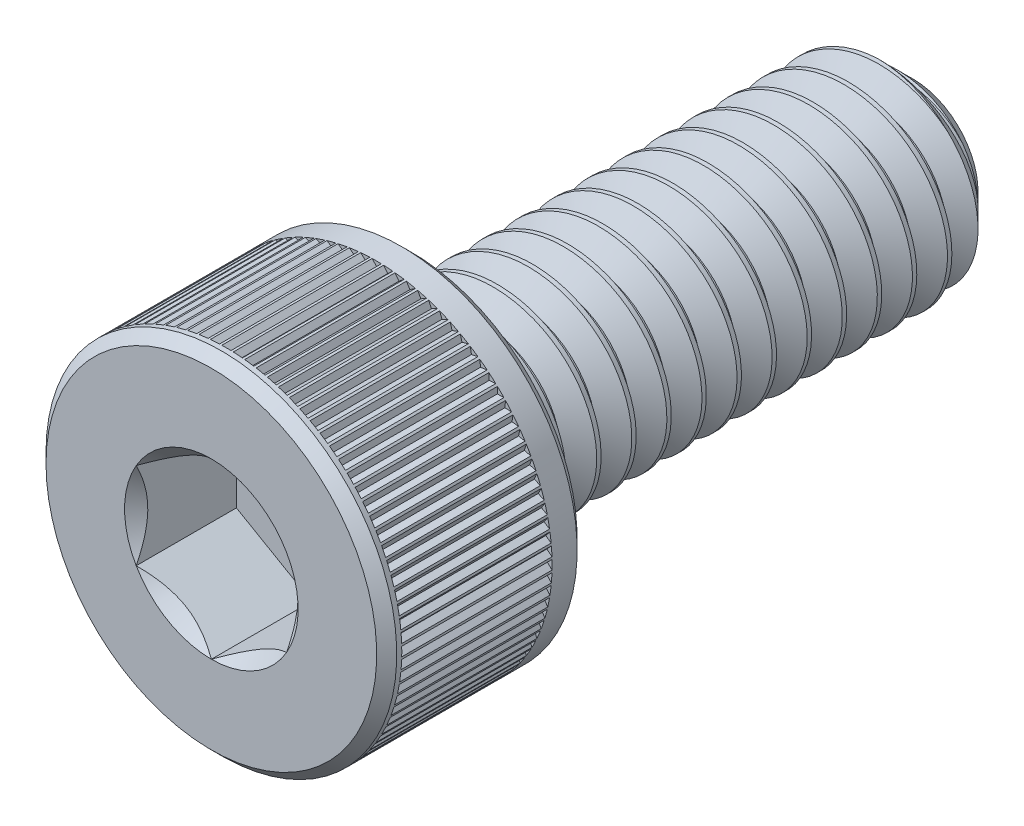
from build123d import *

# Parameters (mm, degrees)
CUT_EXTRUDE1_START = -2
CUT_EXTRUDE1_DEPTH = 2
SKETCH4_R          = 1.732050808
CUT_EXTRUDE2_DEPTH = 0.5
CUT_EXTRUDE2_DRAFT = -45
CUT_SWEEP1_PITCH   = 0.7
CUT_SWEEP1_TO      = 10
CUT_EXTRUDE4_START = -1.3
CUT_EXTRUDE4_DEPTH = 3
CIRPATTERN2_COUNT  = 96


with BuildPart() as part:
    # Sketch2 → Revolve1 (revolve)
    with BuildSketch(Plane(origin=(0, 0, 0), x_dir=(0, 0, -1), z_dir=(1, 0, 0)), mode=Mode.PRIVATE) as revolve1_sk:
        Polygon((-6.8, 3.5), (-3.2, 3.5), (-3, 3.3), (-3, 2), (6.3, 2), (7, 1.3), (7, 0), (-7, 0), (-7, 3.3), align=None)
    revolve(revolve1_sk.sketch.rotate(Axis((0, 0, -7), (0, 0, 1)), 90), axis=Axis((0, 0, -7), (0, 0, 1)))

    # Sketch3 → Cut-Extrude1 (cut)
    with BuildSketch(Plane.XY.offset(7).offset(CUT_EXTRUDE1_START)):
        Polygon((0, 1.732050808), (-1.5, 0.866025404), (-1.5, -0.866025404), (0, -1.732050808), (1.5, -0.866025404), (1.5, 0.866025404), align=None)
    extrude(amount=CUT_EXTRUDE1_DEPTH, mode=Mode.SUBTRACT)


with BuildPart() as cut_extrude2_tool:
    # Sketch4 → Cut-Extrude2 (with draft: the straight prism first)
    with BuildSketch(Plane.XY.offset(7)):
        Circle(SKETCH4_R)
    extrude(amount=-CUT_EXTRUDE2_DEPTH)
    # Cut-Extrude2: the draft: its side faces are tilted about the plane it starts from
    cut_extrude2_sides = [cut_extrude2_tool.faces().sort_by_distance(p)[0] for p in [
        (-1.732050808, 0, 6.75),
    ]]
    draft(cut_extrude2_sides, Plane.XY.offset(7), CUT_EXTRUDE2_DRAFT)


with BuildPart() as part_1:
    add(part.part)

    # Cut-Extrude2: cut by cut_extrude2_tool
    add(cut_extrude2_tool.part, mode=Mode.SUBTRACT)


with BuildPart() as body_2:
    # Split1: read off the stored shape, not the designer's step
    # Split1: the piece on the far side of the plane
    add(part_1.part)
    split(bisect_by=Plane.XY.offset(3), keep=Keep.BOTTOM)

    # Cut-Sweep1: arcs per turn and ends read off the stored shape
    # Cut-Sweep1: the profile of Sketch7 screwed along a right-hand helix through 15.285714 turns, 6 arcs to a turn; built about Z, then put on its axis
    cut_sweep1_z = Axis((0, 0, 0), (0, 0, 1))
    cut_sweep1_corners = [(2.037888611, 0, 0.021875), (2.037888611, 0, -0.634375), (1.545336663, 0, -0.35), (1.545336663, 0, -0.2625)]
    with BuildLine(mode=Mode.PRIVATE) as cut_sweep1_profile:
        Line(cut_sweep1_corners[0], cut_sweep1_corners[1])
        Line(cut_sweep1_corners[1], cut_sweep1_corners[2])
        Line(cut_sweep1_corners[2], cut_sweep1_corners[3])
        Line(cut_sweep1_corners[3], cut_sweep1_corners[0])
    cut_sweep1_cap = Face(cut_sweep1_profile.wire())
    cut_sweep1_turn_angles = [0, 30, 60, 90, 120, 150, 180, 210, 240, 270, 300, 330, 360]
    cut_sweep1_turn_weights = [1, 0.8660254037844387, 1, 0.8660254037844387, 1, 0.8660254037844387, 1, 0.8660254037844387, 1, 0.8660254037844387, 1, 0.8660254037844387, 1]
    cut_sweep1_turn_rails = [Edge.make_bspline([Vector(p[0], p[1], 0).rotate(cut_sweep1_z, cut_sweep1_turn_angles[k]) / cut_sweep1_turn_weights[k] + Vector(0, 0, p[2] + CUT_SWEEP1_PITCH * cut_sweep1_turn_angles[k] / 360) for k in range(13)], [0, 0, 0, 1, 1, 2, 2, 3, 3, 4, 4, 5, 5, 6, 6, 6], 2, cut_sweep1_turn_weights) for p in cut_sweep1_corners]
    cut_sweep1_turn_sides = [Face.make_surface_from_curves(cut_sweep1_turn_rails[p[0]], cut_sweep1_turn_rails[p[1]]) for p in [(0, 1), (1, 2), (2, 3), (3, 0)]]
    cut_sweep1_last_angles = [5400, 5430, 5460, 5481.428571429, 5502.857142857]
    cut_sweep1_last_weights = [1, 0.8660254037844387, 1, 0.930873748644215, 1]
    cut_sweep1_last_rails = [Edge.make_bspline([Vector(p[0], p[1], 0).rotate(cut_sweep1_z, cut_sweep1_last_angles[k]) / cut_sweep1_last_weights[k] + Vector(0, 0, p[2] + CUT_SWEEP1_PITCH * cut_sweep1_last_angles[k] / 360) for k in range(5)], [0, 0, 0, 1, 1, 2, 2, 2], 2, cut_sweep1_last_weights) for p in cut_sweep1_corners]
    cut_sweep1_last_sides = [Face.make_surface_from_curves(cut_sweep1_last_rails[p[0]], cut_sweep1_last_rails[p[1]]) for p in [(0, 1), (1, 2), (2, 3), (3, 0)]]
    cut_sweep1 = Plane(origin=(0, 0, -7), x_dir=(0, 1, 0), z_dir=(0, 0, 1)) * split(Solid(Shell([*[p.moved(Location((0, 0, CUT_SWEEP1_PITCH * i))) for i in range(15) for p in cut_sweep1_turn_sides], *cut_sweep1_last_sides, cut_sweep1_cap, cut_sweep1_cap.rotate(cut_sweep1_z, 5502.857142857).moved(Location((0, 0, CUT_SWEEP1_PITCH * 5502.857142857 / 360)))])), bisect_by=Plane.XY.offset(CUT_SWEEP1_TO), keep=Keep.BOTTOM, mode=Mode.PRIVATE)
    add(cut_sweep1, mode=Mode.SUBTRACT)


with BuildPart() as part_2:
    add(part_1.part)

    # Split1
    split(bisect_by=Plane.XY.offset(3), keep=Keep.TOP)

    add(body_2.part)  # Boss-Extrude1 merges body 2
    # Boss-Extrude1: read off the stored shape, not the designer's step
    # Boss-Extrude1 outline → Boss-Extrude1 (revolve)
    with BuildSketch(Plane.XZ):
        Polygon((1.545332369, 3), (1.545332369, 2.545332369), (2, 3), align=None)
    revolve(axis=Axis((0, 0, 0), (0, 0, 1)))

    # Sketch9 → Cut-Extrude4 (cut)
    with BuildSketch(Plane.XY.offset(5).offset(CUT_EXTRUDE4_START)):
        with BuildLine():
            Line((0, 3.40375), (0.091619319, 3.498800637))
            ThreePointArc((0.091619319, 3.498800637), (0, 3.5), (-0.091619319, 3.498800637))
            Line((-0.091619319, 3.498800637), (0, 3.40375))
        make_face()
    cut_extrude4 = extrude(amount=CUT_EXTRUDE4_DEPTH, mode=Mode.SUBTRACT)

    # CirPattern2: Cut-Extrude4 ×96 about axis
    cirpattern2_axis = Axis((0, 0, 0), (0, 0, 1))
    for i in range(1, CIRPATTERN2_COUNT):
        add(cut_extrude4.rotate(cirpattern2_axis, i * 360 / CIRPATTERN2_COUNT), mode=Mode.SUBTRACT)


solid = part_2.part
